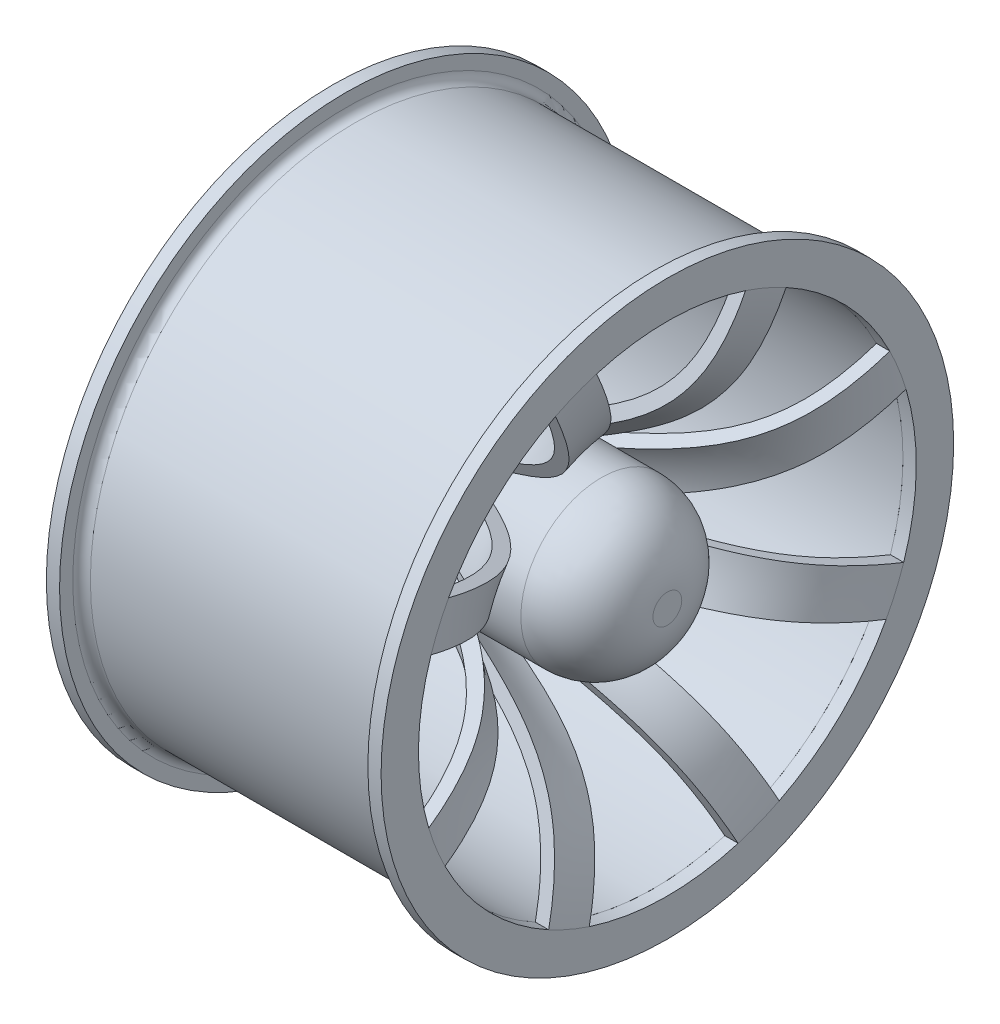
from build123d import *
from build123d.topology import SkipClean

# Parameters (mm, degrees)
SKETCH3_R           = 18.266988819
SKETCH3_R_2         = 15
BOSS_EXTRUDE1_DEPTH = 60
BOSS_EXTRUDE2_START = -20
SKETCH5_R           = 18.266988819
BOSS_EXTRUDE2_DEPTH = 20
CUT_EXTRUDE1_DEPTH  = 120.272796563
FILLET1_R           = 15


with BuildPart() as part:
    # Sketch2 → Revolve1 (revolve)
    with BuildSketch(Plane.XY):
        with BuildLine():
            Line((-38, 65), (-35, 65))
            Line((-35, 65), (-35, 62))
            ThreePointArc((-35, 62), (-34.414213562, 60.585786438), (-33, 60))
            Line((-33, 60), (33, 60))
            ThreePointArc((33, 60), (34.414213562, 60.585786438), (35, 62))
            Line((35, 62), (35, 65))
            Line((35, 65), (38, 65))
            Line((38, 65), (38, 56.513265096))
            add(Edge.make_bspline(
                [(38, 56.513265096), (37.514124891, 51.759740214), (33.049687898, 30.878202523), (17.668554214, 22.671079645), (0, 15)],
                knots=[0, 0, 0, 0, 0.221556779, 1, 1, 1, 1], degree=3))
            Line((0, 15), (-0.012628145, 18.266988819))
            add(Edge.make_bspline(
                [(35.015549706, 56.818316642), (34.885808481, 55.549002508), (34.546336995, 52.995920351), (33.565633614, 48.116395456), (31.778112666, 42.600739665), (28.757559667, 37.218368838), (24.824412271, 32.626397818), (19.900201791, 28.582492348), (14.932587107, 25.499087674), (10.443706031, 23.115409523), (6.825289442, 21.3460411), (3.59874451, 19.864429219), (1.379101379, 18.877984748), (0.387334398, 18.442125949), (0.085090892, 18.30974411), (-0.012628145, 18.266988819)],
                knots=[0, 0, 0, 0, 0.0625, 0.125, 0.25, 0.375, 0.5, 0.625, 0.75, 0.8125, 0.875, 0.9375, 0.96875, 0.977995687, 0.98239655, 0.98239655, 0.98239655, 0.98239655], degree=3))
            Line((35.015549706, 56.818316642), (34.983583101, 56.513265096))
            Line((34.983583101, 56.513265096), (-38, 56.513265096))
            Line((-38, 56.513265096), (-38, 65))
        make_face()
    revolve(axis=Axis((0, 0, 0), (1, 0, 0)))

    # Sketch3 → Boss-Extrude1 (add)
    with BuildSketch(Plane.ZY.offset(38)):
        Circle(SKETCH3_R)
        Circle(SKETCH3_R_2, mode=Mode.SUBTRACT)
    extrude(amount=-BOSS_EXTRUDE1_DEPTH)

    # Sketch5 → Boss-Extrude2 (add)
    with BuildSketch(Plane(origin=(38, 0, 0), x_dir=(0, 0, -1), z_dir=(1, 0, 0)).offset(BOSS_EXTRUDE2_START)):
        Circle(SKETCH5_R)
    extrude(amount=BOSS_EXTRUDE2_DEPTH)

    # Sketch6 → Cut-Extrude1 (cut, through all)
    with SkipClean():  # the faces are left unmerged after this step: merging them gives an invalid solid
        with BuildSketch(Plane(origin=(38, 0, 0), x_dir=(0, 0, -1), z_dir=(1, 0, 0))):
            with BuildLine():
                ThreePointArc((-11.375967274, 14.292314337), (-9.845390149, 15.386720681), (-8.210352957, 16.317873171))
                Line((-8.210352957, 16.317873171), (-25.400675381, 50.48321327))
                ThreePointArc((-25.400675381, 50.48321327), (-39.337674501, 40.57457944), (-49.672900151, 26.950920623))
                Line((-49.672900151, 26.950920623), (-11.375967274, 14.292314337))
            make_face()
            with BuildLine():
                Line((-16.066865806, 54.18122327), (2.062168785, 18.150215988))
                ThreePointArc((2.062168785, 18.150215988), (3.918312396, 17.841796672), (5.732882522, 17.344075026))
                Line((5.732882522, 17.344075026), (17.73603263, 53.658012248))
                ThreePointArc((17.73603263, 53.658012248), (0.87462387, 56.506496661), (-16.066865806, 54.18122327))
            make_face()
            with BuildLine():
                ThreePointArc((-18.150215988, 2.062168785), (-17.841796672, 3.918312396), (-17.344075026, 5.732882522))
                Line((-17.344075026, 5.732882522), (-53.658012248, 17.73603263))
                ThreePointArc((-53.658012248, 17.73603263), (-56.506496661, 0.87462387), (-54.18122327, -16.066865806))
                Line((-54.18122327, -16.066865806), (-18.150215988, 2.062168785))
            make_face()
            with BuildLine():
                Line((26.950920623, 49.672900151), (14.292314337, 11.375967274))
                ThreePointArc((14.292314337, 11.375967274), (15.386720681, 9.845390149), (16.317873171, 8.210352957))
                Line((16.317873171, 8.210352957), (50.48321327, 25.400675381))
                ThreePointArc((50.48321327, 25.400675381), (40.57457944, 39.337674501), (26.950920623, 49.672900151))
            make_face()
            with BuildLine():
                ThreePointArc((-14.292314337, -11.375967274), (-15.386720681, -9.845390149), (-16.317873171, -8.210352957))
                Line((-16.317873171, -8.210352957), (-50.48321327, -25.400675381))
                ThreePointArc((-50.48321327, -25.400675381), (-40.57457944, -39.337674501), (-26.950920623, -49.672900151))
                Line((-26.950920623, -49.672900151), (-14.292314337, -11.375967274))
            make_face()
            with BuildLine():
                ThreePointArc((53.658012248, -17.73603263), (56.506496661, -0.87462387), (54.18122327, 16.066865806))
                Line((54.18122327, 16.066865806), (18.150215988, -2.062168785))
                ThreePointArc((18.150215988, -2.062168785), (17.841796672, -3.918312396), (17.344075026, -5.732882522))
                Line((17.344075026, -5.732882522), (53.658012248, -17.73603263))
            make_face()
            with BuildLine():
                ThreePointArc((-2.062168785, -18.150215988), (-3.918312396, -17.841796672), (-5.732882522, -17.344075026))
                Line((-5.732882522, -17.344075026), (-17.73603263, -53.658012248))
                ThreePointArc((-17.73603263, -53.658012248), (-0.87462387, -56.506496661), (16.066865806, -54.18122327))
                Line((16.066865806, -54.18122327), (-2.062168785, -18.150215988))
            make_face()
            with BuildLine():
                Line((49.672900151, -26.950920623), (11.375967274, -14.292314337))
                ThreePointArc((11.375967274, -14.292314337), (9.845390149, -15.386720681), (8.210352957, -16.317873171))
                Line((8.210352957, -16.317873171), (25.400675381, -50.48321327))
                ThreePointArc((25.400675381, -50.48321327), (39.337674501, -40.57457944), (49.672900151, -26.950920623))
            make_face()
        extrude(amount=-CUT_EXTRUDE1_DEPTH, mode=Mode.SUBTRACT)

    # Fillet1
    fillet1_edges = [part.edges().sort_by_distance(p)[0] for p in [
        (38, 4.219269708, -17.773031357),
        (18, 0, -15),
    ]]
    fillet(fillet1_edges, radius=FILLET1_R)


solid = part.part
